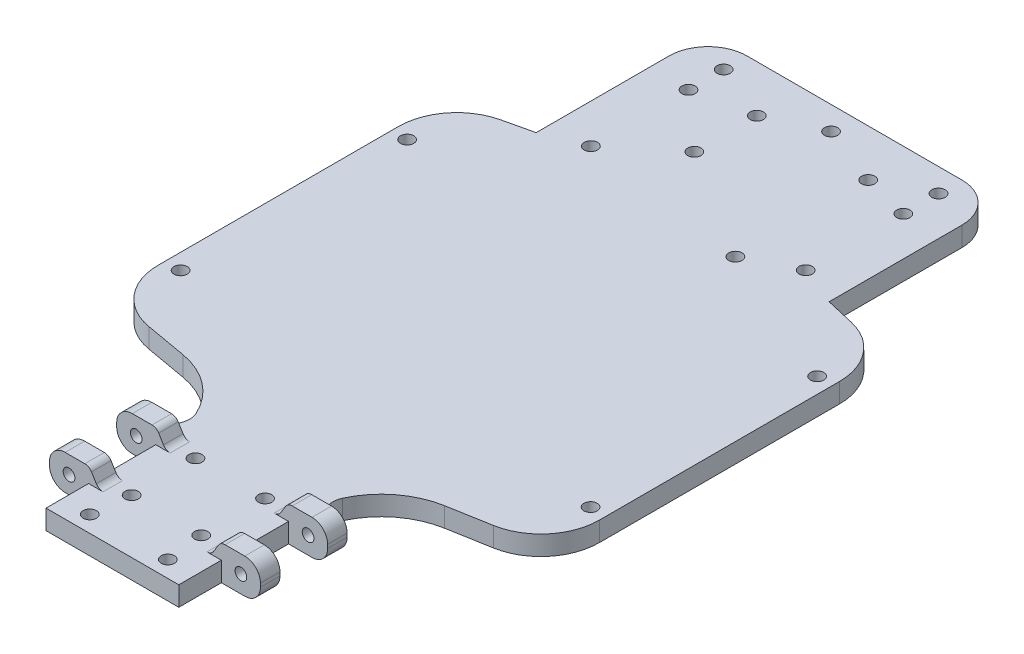
from build123d import *

# Parameters (mm, degrees)
BOSS_EXTRU_1_DEPTH      = 5
CONG_1_R                = 20
CONG_2_R                = 5
BOSS_EXTRU_2_DEPTH      = 5
CONG_4_R                = 2
CONG_5_R                = 4
ESQUISSE3_R             = 1.5
ENL_V_MAT_EXTRU_2_DEPTH = 25
ESQUISSE4_R             = 1.7
ENL_V_MAT_EXTRU_3_DEPTH = 25
ESQUISSE5_R             = 1.7
ENL_V_MAT_EXTRU_4_DEPTH = 10
ESQUISSE6_R             = 1.7
ENL_V_MAT_EXTRU_5_DEPTH = 10
CONG_6_R                = 10


with BuildPart() as part:
    # Esquisse1 → Boss.-Extru.1 (new body)
    with BuildSketch(Plane(origin=(0, 0, 0), x_dir=(1, 0, 0), z_dir=(0, 1, 0))):
        with BuildLine():
            Line((-37.5, 95), (37.5, 95))
            Line((37.5, 95), (37.5, 51))
            Line((37.5, 51), (44.874265815, 49.29751659))
            ThreePointArc((44.874265815, 49.29751659), (53.239122353, 44.019685168), (56.5, 34.681965619))
            Line((56.5, 34.681965619), (56.5, -26.800001164))
            ThreePointArc((56.5, -26.800001164), (52.990666647, -36.441815309), (44.104722665, -41.572117459))
            Line((44.104722665, -41.572117459), (17, -46.351411369))
            Line((17, -46.351411369), (17, -61.9))
            Line((17, -61.9), (27, -61.9))
            Line((27, -61.9), (27, -66.9))
            Line((27, -66.9), (17, -66.9))
            Line((17, -66.9), (17, -79.1))
            Line((17, -79.1), (27, -79.1))
            Line((27, -79.1), (27, -84.1))
            Line((27, -84.1), (17, -84.1))
            Line((17, -84.1), (17, -95))
            Line((17, -95), (-17, -95))
            Line((-17, -95), (-17, -84.1))
            Line((-17, -84.1), (-27, -84.1))
            Line((-27, -84.1), (-27, -79.1))
            Line((-27, -79.1), (-17, -79.1))
            Line((-17, -79.1), (-17, -66.9))
            Line((-17, -66.9), (-27, -66.9))
            Line((-27, -66.9), (-27, -61.9))
            Line((-27, -61.9), (-17, -61.9))
            Line((-17, -61.9), (-17, -46.351411369))
            Line((-17, -46.351411369), (-44.104722665, -41.572117459))
            ThreePointArc((-44.104722665, -41.572117459), (-52.990666647, -36.441815309), (-56.5, -26.800001164))
            Line((-56.5, -26.800001164), (-56.5, 34.681965619))
            ThreePointArc((-56.5, 34.681965619), (-53.239122353, 44.019685168), (-44.874265815, 49.29751659))
            Line((-44.874265815, 49.29751659), (-37.5, 51))
            Line((-37.5, 51), (-37.5, 95))
        make_face()
    extrude(amount=BOSS_EXTRU_1_DEPTH)

    # Congé1
    # the kernel refuses this fillet: 20 mm, written as the material it adds along each edge
    with BuildSketch(Plane(origin=(17, 0, 46.351411369), x_dir=(0.9848077530122094, 0, -0.1736481776669235), z_dir=(0, 1, 0))) as cong_1_piece_1:
        with BuildLine():
            CenterArc((16.742910017, -20), CONG_1_R, 90, 76.444834731)
            Line((-2.699984081, -15.312370632), (-3.088841963, -15.218618044))
            ThreePointArc((-3.088841963, -15.218618044), (-1.743915142, -7.586726045), (-0.393923101, 0.069459271))
            Line((-0.393923101, 0.069459271), (0, 0.4))
            Line((0, 0.4), (16.742910017, 0.4))
            Line((16.742910017, 0.4), (16.742910017, 0))
        make_face()
    extrude(amount=5)
    with BuildSketch(Plane(origin=(-17, 0, 46.351411369), x_dir=(0, 0, 1), z_dir=(0, 1, 0))) as cong_1_piece_2:
        with BuildLine():
            CenterArc((16.788779247, -19.961511146), CONG_1_R, 93.555165269, 76.444834731)
            Line((-2.907375813, -16.488547593), (-3.301298915, -16.419088322))
            Line((-3.301298915, -16.419088322), (-0.393923101, 0.069459271))
            Line((-0.393923101, 0.069459271), (0, 0.4))
            ThreePointArc((0, 0.4), (7.774294315, 0.4), (15.523784818, 0.399230223))
            Line((15.523784818, 0.399230223), (15.548588631, 0))
        make_face()
    extrude(amount=5)

    # Congé2
    cong_2_edges = [part.edges().sort_by_distance(p)[0] for p in [
        (-17, 2.5, 61.9),
        (17, 2.5, 61.9),
    ]]
    fillet(cong_2_edges, radius=CONG_2_R)

    # Esquisse2 → Boss.-Extru.2 (add)
    with BuildSketch(Plane.XY.offset(84.1)):
        Polygon((-27, 5), (-27, 8.904402326), (-16.833134842, 8.904402326), (-14.427579086, 5), (-14.427579086, 0), (-27, 0), align=None)
        Polygon((16.833134842, 8.904402326), (14.427579086, 5), (14.427579086, 0), (27, 0), (27, 5), (27, 8.904402326), align=None)
    boss_extru_2 = extrude(amount=-BOSS_EXTRU_2_DEPTH)

    # Symétrie1: Boss.-Extru.2 across plane
    add(boss_extru_2.mirror(Plane.XY.offset(73)))

    # Congé4
    cong_4_edges = [part.edges().sort_by_distance(p)[0] for p in [
        (16.833134842, 8.904402326, 81.6),
        (14.427579086, 5, 81.6),
        (-16.833134842, 8.904402326, 81.6),
        (-14.427579086, 5, 81.6),
        (16.833134842, 8.904402326, 64.4),
        (14.427579086, 5, 64.4),
        (-14.427579086, 5, 64.4),
        (-16.833134842, 8.904402326, 64.4),
    ]]
    fillet(cong_4_edges, radius=CONG_4_R)

    # Congé5
    cong_5_edges = [part.edges().sort_by_distance(p)[0] for p in [
        (27, 8.904402326, 81.6),
        (-27, 8.904402326, 81.6),
        (27, 8.904402326, 64.4),
        (-27, 8.904402326, 64.4),
        (-27, 0, 64.4),
        (-27, 0, 81.6),
        (27, 0, 81.6),
        (27, 0, 64.4),
    ]]
    fillet(cong_5_edges, radius=CONG_5_R)

    # Esquisse3 → Enlèv. mat.-Extru.2 (cut)
    with BuildSketch(Plane.XY.offset(84.1)):
        with Locations((-22, 4.452201163)):
            Circle(ESQUISSE3_R)
        with Locations(Location((22, 4.452201163, 0), (0, 0, 331.733302731))):
            Circle(ESQUISSE3_R)
    extrude(amount=-ENL_V_MAT_EXTRU_2_DEPTH, mode=Mode.SUBTRACT)

    # Esquisse4 → Enlèv. mat.-Extru.3 (cut)
    with BuildSketch(Plane(origin=(0, 5, 0), x_dir=(1, 0, 0), z_dir=(0, 1, 0))):
        with Locations(Location((-10, -90.8, 0), (0, 0, 270))):
            Circle(ESQUISSE4_R)
        with Locations(Location((10, -90.8, 0), (0, 0, 270))):
            Circle(ESQUISSE4_R)
        with Locations(Location((8.90673672, -64.828011588, 0), (0, 0, 270))):
            Circle(ESQUISSE4_R)
        with Locations(Location((8.90673672, -81.171988412, 0), (0, 0, 270))):
            Circle(ESQUISSE4_R)
        with Locations(Location((-8.90673672, -81.171988412, 0), (0, 0, 270))):
            Circle(ESQUISSE4_R)
        with Locations(Location((-8.90673672, -64.828011588, 0), (0, 0, 270))):
            Circle(ESQUISSE4_R)
    extrude(amount=-ENL_V_MAT_EXTRU_3_DEPTH, mode=Mode.SUBTRACT)

    # Esquisse5 → Enlèv. mat.-Extru.4 (cut)
    with BuildSketch(Plane(origin=(0, 5, 0), x_dir=(1, 0, 0), z_dir=(0, 1, 0))):
        with Locations(Location((15.5, 83, 0), (0, 0, 270))):
            Circle(ESQUISSE5_R)
        with Locations(Location((15.5, 49, 0), (0, 0, 270))):
            Circle(ESQUISSE5_R)
        with Locations(Location((-13, 83, 0), (0, 0, 270))):
            Circle(ESQUISSE5_R)
        with Locations(Location((-13, 67, 0), (0, 0, 270))):
            Circle(ESQUISSE5_R)
        with Locations(Location((27.5, 80, 0), (0, 0, 270))):
            Circle(ESQUISSE5_R)
        with Locations(Location((27.5, 55, 0), (0, 0, 270))):
            Circle(ESQUISSE5_R)
        with Locations(Location((27.5, 89, 0), (0, 0, 270))):
            Circle(ESQUISSE5_R)
        with Locations(Location((-27.5, 89, 0), (0, 0, 270))):
            Circle(ESQUISSE5_R)
        with Locations(Location((-27.5, 80, 0), (0, 0, 270))):
            Circle(ESQUISSE5_R)
        with Locations(Location((-27.5, 55, 0), (0, 0, 270))):
            Circle(ESQUISSE5_R)
        with Locations(Location((0, 89, 0), (0, 0, 270))):
            Circle(ESQUISSE5_R)
    extrude(amount=-ENL_V_MAT_EXTRU_4_DEPTH, mode=Mode.SUBTRACT)

    # Esquisse6 → Enlèv. mat.-Extru.5 (cut)
    with BuildSketch(Plane(origin=(0, 5, 0), x_dir=(1, 0, 0), z_dir=(0, 1, 0))):
        with Locations(Location((-52.484739006, 32.940982227, 0), (0, 0, 270))):
            Circle(ESQUISSE6_R)
        with Locations(Location((-52.484739006, -25.059017773, 0), (0, 0, 270))):
            Circle(ESQUISSE6_R)
        with Locations(Location((52.484739006, -25.059017773, 0), (0, 0, 90))):
            Circle(ESQUISSE6_R)
        with Locations(Location((52.484739006, 32.940982227, 0), (0, 0, 90))):
            Circle(ESQUISSE6_R)
    extrude(amount=-ENL_V_MAT_EXTRU_5_DEPTH, mode=Mode.SUBTRACT)

    # Congé6
    cong_6_edges = [part.edges().sort_by_distance(p)[0] for p in [
        (37.5, 2.5, -95),
        (-37.5, 2.5, -95),
    ]]
    fillet(cong_6_edges, radius=CONG_6_R)


solid = part.part
